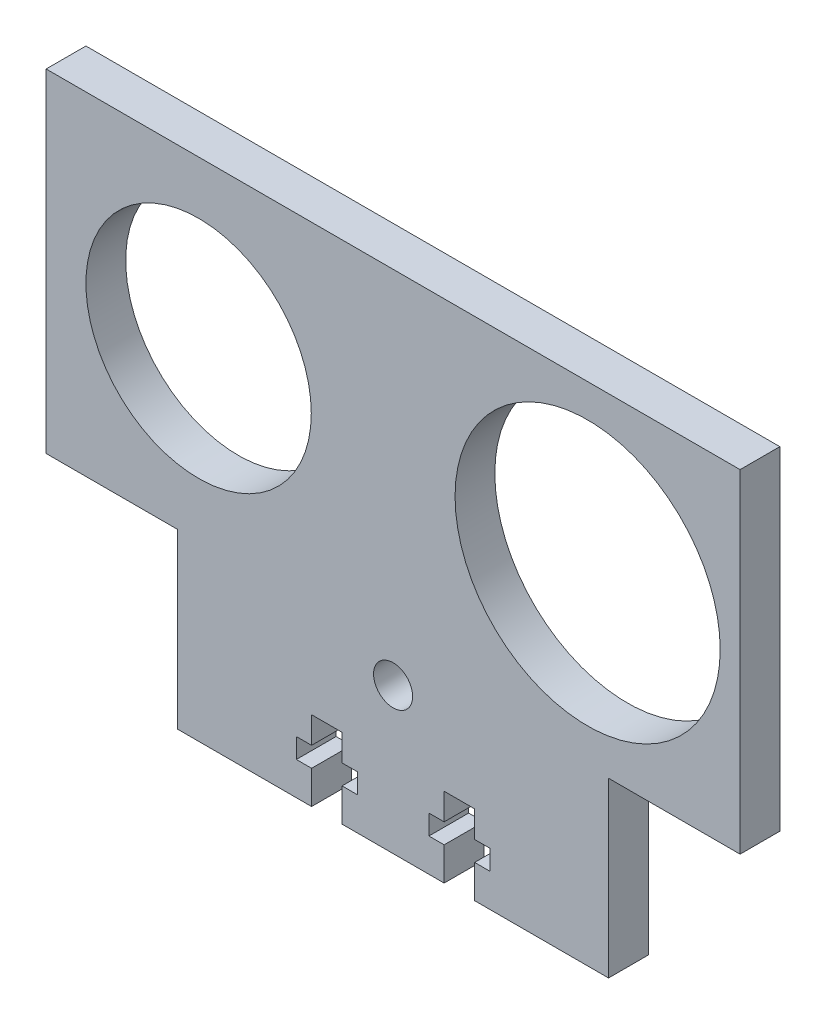
from build123d import *

# Parameters (mm, degrees)
SKETCH1_R           = 2.95
SKETCH1_R_2         = 17
SKETCH1_R_3         = 20
BOSS_EXTRUDE1_DEPTH = 6
CUT_EXTRUDE2_DEPTH  = 76.692558526


with BuildPart() as part:
    # Sketch1 → Boss-Extrude1 (new body)
    with BuildSketch(Plane.XY):
        Polygon((-32.5, 4.1), (-32.5, -22), (32.5, -22), (32.5, 4.1), (52.344931419, 4.1), (52.344931419, 54.344931419), (-52.344931419, 54.344931419), (-52.344931419, 4.1), align=None)
        Circle(SKETCH1_R, mode=Mode.SUBTRACT)
        with Locations((-29.344931419, 29.344931419)):
            Circle(SKETCH1_R_2, mode=Mode.SUBTRACT)
        with Locations((29.344931419, 29.344931419)):
            Circle(SKETCH1_R_3, mode=Mode.SUBTRACT)
    extrude(amount=BOSS_EXTRUDE1_DEPTH)

    # Sketch3 → Cut-Extrude2 (cut, through all)
    with BuildSketch(Plane.XY.offset(6)):
        Polygon((-12.3, -22), (-7.7, -22), (-7.7, -17), (-5.4, -17), (-5.4, -14), (-7.7, -14), (-7.7, -10), (-12.3, -10), (-12.3, -14), (-14.6, -14), (-14.6, -17), (-12.3, -17), align=None)
        Polygon((7.7, -14), (7.7, -10), (12.3, -10), (12.3, -14), (14.6, -14), (14.6, -17), (12.3, -17), (12.3, -22), (7.7, -22), (7.7, -17), (5.4, -17), (5.4, -14), align=None)
    extrude(amount=-CUT_EXTRUDE2_DEPTH, mode=Mode.SUBTRACT)


solid = part.part
